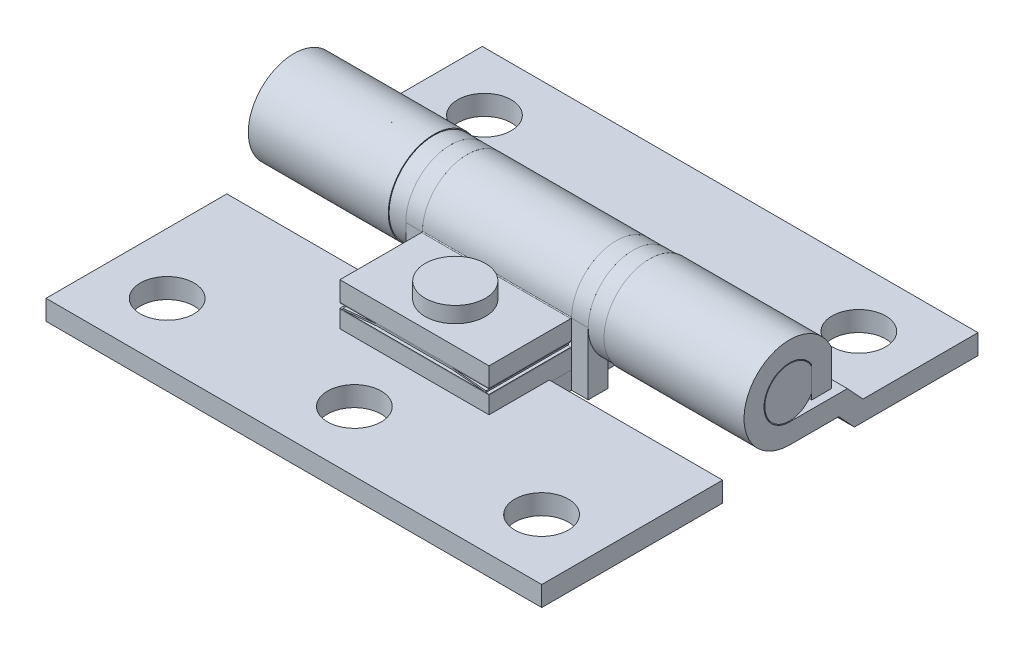
from build123d import *

# Parameters (mm, degrees)
EXTRUDE1_DEPTH                      = 19.84375
CUT_EXTRUDE1_DEPTH                  = 26.420828413
CUT_EXTRUDE1_DEPTH_BACK             = 26.420828413
SKETCH2_W                           = 17.272
SKETCH2_H                           = 9.53123
EXTRUDE2_START                      = -19.84375
EXTRUDE2_DEPTH                      = 39.6875
SKETCH16_W                          = 13.87475
SKETCH16_H                          = 8.730382454
CUT_EXTRUDE4_DEPTH                  = 29.93524198
EXTRUDE7_DEPTH                      = 1.3335
SKETCH18_R                          = 3.584575
SKETCH18_R_2                        = 1.984375
EXTRUDE8_DEPTH                      = 1.3335
EXTRUDE9_START                      = -5.969
EXTRUDE9_DEPTH                      = 11.938
EXTRUDE10_START                     = -5.969
SKETCH21_W                          = 6.54177
SKETCH21_H                          = 0.065405
EXTRUDE10_DEPTH                     = 11.938
EXTRUDE12_REACH                     = 30.505
SKETCH24_W                          = 6.54177
SKETCH24_H                          = 0.065405
EXTRUDE12_DIRECTION_2_REACH         = 30.505
EXTRUDE11_DEPTH                     = 6.607175
EXTRUDE5_START                      = -19.84375
EXTRUDE5_DEPTH                      = 39.6875
SKETCH10_W                          = 2.1463
SKETCH10_H                          = 1.6002
F_8_0_199_DIAMETER_HOLE1_AT_2_COUNT = 2
F_8_0_199_DIAMETER_HOLE1_AT_2_PITCH = 29.972
F_8_0_199_DIAMETER_HOLE1_AT_3_COUNT = 2
F_8_0_199_DIAMETER_HOLE1_AT_3_PITCH = 25.4
F_8_0_199_DIAMETER_HOLE1_AT_4_COUNT = 2
F_8_0_199_DIAMETER_HOLE1_AT_4_PITCH = 39.287158004
F_8_0_199_DIAMETER_HOLE1_AT_5_COUNT = 2
F_8_0_199_DIAMETER_HOLE1_AT_5_PITCH = 29.491357988
CUT_EXTRUDE3_START                  = -3.3998
SKETCH14_R                          = 2.04517625
CUT_EXTRUDE3_DEPTH                  = 3.3998


# Read off the part's stored shape, not the designer's step: Extrude9
with BuildPart() as part:
    # Sketch1 → Extrude1 (new, symmetric)
    with BuildSketch(Plane(origin=(0, 0, 0), x_dir=(0, 0, -1), z_dir=(1, 0, 0))):
        with BuildLine():
            Line((15.08125, -3.39980016), (5.88125, -3.39980016))
            Line((5.88125, -3.39980016), (4.623019052, -2.04978))
            Line((4.623019052, -2.04978), (0, -2.04978))
            ThreePointArc((0, -2.04978), (-1.780454512, 1.01566716), (1.764432454, 1.043252684))
            Line((1.764432454, 1.043252684), (1.764432454, -1.41478))
            Line((1.764432454, -1.41478), (3.364632454, -1.41478))
            Line((3.364632454, -1.41478), (3.364632454, 1.41478))
            ThreePointArc((3.364632454, 1.41478), (-3.040252679, 2.019707317), (0, -3.64998))
            Line((0, -3.64998), (3.926974683, -3.64998))
            Line((3.926974683, -3.64998), (5.18520563, -5.00000016))
            Line((5.18520563, -5.00000016), (15.08125, -5.00000016))
            Line((15.08125, -5.00000016), (15.08125, -3.39980016))
        make_face()
    extrude(amount=EXTRUDE1_DEPTH, both=True)

    # Sketch2 → Cut-Extrude1 (cut, two sides: drawn at the far end of the back side and taken through both)
    with BuildSketch(Plane(origin=(0, 0, 0), x_dir=(1, 0, 0), z_dir=(0, 1, 0)).offset(-CUT_EXTRUDE1_DEPTH_BACK)):
        with Locations((0, 1.115635)):
            Rectangle(SKETCH2_W, SKETCH2_H)
    extrude(amount=CUT_EXTRUDE1_DEPTH + CUT_EXTRUDE1_DEPTH_BACK, mode=Mode.SUBTRACT)

    # Sketch10 → #8 (0.199) Diameter Hole1 (revolve, cut)
    with BuildSketch(Plane(origin=(-14.986, -3.39980016, -10.4), x_dir=(0, 0, 1), z_dir=(1, 0, 0))):
        with Locations((1.07315, 0.8001)):
            Rectangle(SKETCH10_W, SKETCH10_H)
    f_8_0_199_diameter_hole1 = revolve(axis=Axis((-14.986, 2.95019984, -10.4), (0, -1, 0)), mode=Mode.SUBTRACT)

    # #8 (0.199) Diameter Hole1 at 2: #8 (0.199) Diameter Hole1 ×2
    with Locations(*[(i * F_8_0_199_DIAMETER_HOLE1_AT_2_PITCH, 0, 0) for i in range(1, F_8_0_199_DIAMETER_HOLE1_AT_2_COUNT)]):
        add(f_8_0_199_diameter_hole1, mode=Mode.SUBTRACT)


with BuildPart() as body_2:
    # Sketch3 → Extrude2 (new body)
    with BuildSketch(Plane(origin=(0, 0, 0), x_dir=(0, 0, -1), z_dir=(1, 0, 0)).offset(EXTRUDE2_START)):
        Polygon((-19.84375, -5.00000016), (-5.36575, -5.00000016), (3.364632454, -5.00000016), (3.364632454, -3.39980016), (-5.36575, -3.39980016), (-19.84375, -3.39980016), align=None)
    extrude(amount=EXTRUDE2_DEPTH)

    # Sketch16 → Cut-Extrude4 (cut, through all)
    with BuildSketch(Plane(origin=(0, -3.39980016, 0), x_dir=(-1, 0, 0), z_dir=(0, 1, 0))):
        with Locations((-12.906375, 1.000558773)):
            Rectangle(SKETCH16_W, SKETCH16_H)
        with Locations((12.906375, 1.000558773)):
            Rectangle(SKETCH16_W, SKETCH16_H)
    extrude(amount=-CUT_EXTRUDE4_DEPTH, mode=Mode.SUBTRACT)

    # Sketch17 → Extrude7 (add)
    with BuildSketch(Plane(origin=(5.969, 0, 0), x_dir=(0, 0, -1), z_dir=(1, 0, 0))):
        with BuildLine():
            Line((1.984375, -5.00000016), (1.984375, 0))
            ThreePointArc((1.984375, 0), (0, 1.984375), (-1.984375, 0))
            Line((-1.984375, 0), (-1.984375, -5.00000016))
            Line((-1.984375, -5.00000016), (-3.584575, -5.00000016))
            Line((-3.584575, -5.00000016), (-3.584575, 0))
            ThreePointArc((-3.584575, 0), (0, 3.584575), (3.584575, 0))
            Line((3.584575, 0), (3.584575, -5.00000016))
            Line((3.584575, -5.00000016), (1.984375, -5.00000016))
        make_face()
    extrude7 = extrude(amount=EXTRUDE7_DEPTH)

    # Mirror3: Extrude7 across plane
    add(extrude7.mirror(Plane(origin=(0, 0, 0), x_dir=(0, 0, 1), z_dir=(1, 0, 0))))

    # #8 (0.199) Diameter Hole1 at 3: #8 (0.199) Diameter Hole1 ×2
    with Locations(*[(0, 0, i * F_8_0_199_DIAMETER_HOLE1_AT_3_PITCH) for i in range(1, F_8_0_199_DIAMETER_HOLE1_AT_3_COUNT)]):
        add(f_8_0_199_diameter_hole1, mode=Mode.SUBTRACT)

    # #8 (0.199) Diameter Hole1 at 4: #8 (0.199) Diameter Hole1 ×2
    with Locations(*[Vector(0.7628956005739062, 0, 0.6465216954016154) * (i * F_8_0_199_DIAMETER_HOLE1_AT_4_PITCH) for i in range(1, F_8_0_199_DIAMETER_HOLE1_AT_4_COUNT)]):
        add(f_8_0_199_diameter_hole1, mode=Mode.SUBTRACT)

    # #8 (0.199) Diameter Hole1 at 5: #8 (0.199) Diameter Hole1 ×2
    with Locations(*[Vector(0.5081488619782861, 0, 0.8612692575903153) * (i * F_8_0_199_DIAMETER_HOLE1_AT_5_PITCH) for i in range(1, F_8_0_199_DIAMETER_HOLE1_AT_5_COUNT)]):
        add(f_8_0_199_diameter_hole1, mode=Mode.SUBTRACT)


with BuildPart() as body_3:
    # Sketch18 → Extrude8 (new body)
    with BuildSketch(Plane.ZY.offset(-8.636)):
        Circle(SKETCH18_R)
        Circle(SKETCH18_R_2, mode=Mode.SUBTRACT)
    extrude(amount=EXTRUDE8_DEPTH)


with BuildPart() as body_4:
    # Mirror4: mirrored copy
    add(body_3.part.mirror(Plane(origin=(0, 0, 0), x_dir=(0, 0, 1), z_dir=(1, 0, 0))))


with BuildPart() as body_5:
    # Extrude9 outline → Extrude9 (new body)
    with BuildSketch(Plane(origin=(0, 0, 0), x_dir=(0, 0, -1), z_dir=(1, 0, 0)).offset(EXTRUDE9_START)):
        with BuildLine():
            Line((-10.19175, -2.04978), (-10.19175, -3.584575))
            Line((-10.19175, -3.584575), (0, -3.584575))
            ThreePointArc((0, -3.584575), (2.557487879, 2.511659547), (-3.583989091, 0.0648084))
            ThreePointArc((-3.583989091, 0.0648084), (-3.603733571, 0.018911445), (-3.64998, 0))
            Line((-3.64998, 0), (-10.19175, 0))
            Line((-10.19175, 0), (-10.19175, -1.534795))
            Line((-10.19175, -1.534795), (-3.64998, -1.534795))
            ThreePointArc((-3.64998, -1.534795), (-2.528325046, -1.076119237), (-2.049444957, 0.037059613))
            ThreePointArc((-2.049444957, 0.037059613), (1.462457197, 1.436251021), (0, -2.04978))
            Line((0, -2.04978), (-10.19175, -2.04978))
        make_face()
    extrude(amount=EXTRUDE9_DEPTH)


with BuildPart() as body_6:
    # Sketch21 → Extrude10 (new body)
    with BuildSketch(Plane(origin=(0, 0, 0), x_dir=(0, 0, -1), z_dir=(1, 0, 0)).offset(EXTRUDE10_START)):
        with Locations((-6.920865, -2.0170775)):
            Rectangle(SKETCH21_W, SKETCH21_H)
    extrude(amount=EXTRUDE10_DEPTH)


with BuildPart() as body_7:

    # Extrude12: up to this face of the body (flat: up to its plane)
    extrude12_end = Plane(body_5.part.faces().sort_by_distance((5.969, -0.844929443, 2.968720728))[0])
    # Sketch24 → Extrude12 (new, up to the picked face)
    with BuildSketch(Plane(origin=(0, 0, 0), x_dir=(0, 0, -1), z_dir=(1, 0, 0)), mode=Mode.PRIVATE) as extrude12_sk1:
        with Locations((-6.920865, -1.5674975)):
            Rectangle(SKETCH24_W, SKETCH24_H)
    extrude12_tool1 = split(extrude(extrude12_sk1.sketch, amount=EXTRUDE12_REACH, mode=Mode.PRIVATE), bisect_by=extrude12_end, keep=Keep.BOTH, mode=Mode.PRIVATE)
    add(extrude12_tool1.solids().sort_by(Axis((0, -1.567498, 6.920865), (1, 0, 0)))[0])


    # Extrude12 direction 2: up to this face of the body (flat: up to its plane)
    extrude12_direction_2_end = Plane(body_5.part.faces().sort_by_distance((-5.969, -0.844929443, 2.968720728))[0])
    # Sketch24 → Extrude12 direction 2 (add, up to the picked face)
    with BuildSketch(Plane(origin=(0, 0, 0), x_dir=(0, 0, -1), z_dir=(1, 0, 0)), mode=Mode.PRIVATE) as extrude12_direction_2_sk1:
        with Locations((-6.920865, -1.5674975)):
            Rectangle(SKETCH24_W, SKETCH24_H)
    extrude12_direction_2_tool1 = split(extrude(extrude12_direction_2_sk1.sketch, amount=-EXTRUDE12_DIRECTION_2_REACH, mode=Mode.PRIVATE), bisect_by=extrude12_direction_2_end, keep=Keep.BOTH, mode=Mode.PRIVATE)
    add(extrude12_direction_2_tool1.solids().sort_by(Axis((0, -1.567498, 6.920865), (-1, 0, 0)))[0])


with BuildPart() as body_8:
    # Sketch22 → Extrude11 (new body)
    with BuildSketch(Plane.XY.offset(10.19175)):
        Polygon((5.715, -1.984375), (2.979752876, -1.7272), (-2.979752876, -1.7272), (-5.715, -1.984375), (-5.726877831, -1.858045448), (-2.9845, -1.6002), (2.9845, -1.6002), (5.726877831, -1.858045448), align=None)
    extrude(amount=-EXTRUDE11_DEPTH)


with BuildPart() as body_9:
    # Sketch6 → Extrude5 (new body)
    with BuildSketch(Plane(origin=(0, 0, 0), x_dir=(0, 0, -1), z_dir=(1, 0, 0)).offset(EXTRUDE5_START)):
        with BuildLine():
            Line((1.764432454, 0.908032078), (1.764432454, -0.908032078))
            ThreePointArc((1.764432454, -0.908032078), (-1.984375, 0), (1.764432454, 0.908032078))
        make_face()
    extrude(amount=EXTRUDE5_DEPTH)


with BuildPart() as cut_extrude3_tool:
    # Sketch14 → Cut-Extrude3 (new body)
    with BuildSketch(Plane(origin=(0, 0, 0), x_dir=(-1, 0, 0), z_dir=(0, 1, 0)).offset(CUT_EXTRUDE3_START)):
        with Locations(Location((0, 6.920865, 0), (0, 0, 90))):
            Circle(SKETCH14_R)
    extrude(amount=CUT_EXTRUDE3_DEPTH)


with BuildPart() as body_5_1:
    add(body_5.part)

    # Cut-Extrude3: cut by cut_extrude3_tool
    add(cut_extrude3_tool.part, mode=Mode.SUBTRACT)


with BuildPart() as body_6_1:
    add(body_6.part)

    # Cut-Extrude3: cut by cut_extrude3_tool
    add(cut_extrude3_tool.part, mode=Mode.SUBTRACT)


with BuildPart() as body_8_1:
    add(body_8.part)

    # Cut-Extrude3: cut by cut_extrude3_tool
    add(cut_extrude3_tool.part, mode=Mode.SUBTRACT)


with BuildPart() as body_10:
    # Sketch23 → Revolve2 (revolve)
    with BuildSketch(Plane(origin=(0, 0, 0), x_dir=(0, 0, -1), z_dir=(1, 0, 0)), mode=Mode.PRIVATE) as revolve2_sk:
        Polygon((-6.920865, 1.27), (-6.920865, -3.39980016), (-4.87568875, -3.39980016), (-4.87568875, 0), (-4.507865, 0), (-4.507865, 1.27), align=None)
    revolve(revolve2_sk.sketch.rotate(Axis((0, 1.27, 6.920865), (0, -1, 0)), 180), axis=Axis((0, 1.27, 6.920865), (0, -1, 0)))


solid = Compound([part.part, body_2.part, body_3.part, body_4.part, body_7.part, body_9.part, body_5_1.part, body_6_1.part, body_8_1.part, body_10.part])
